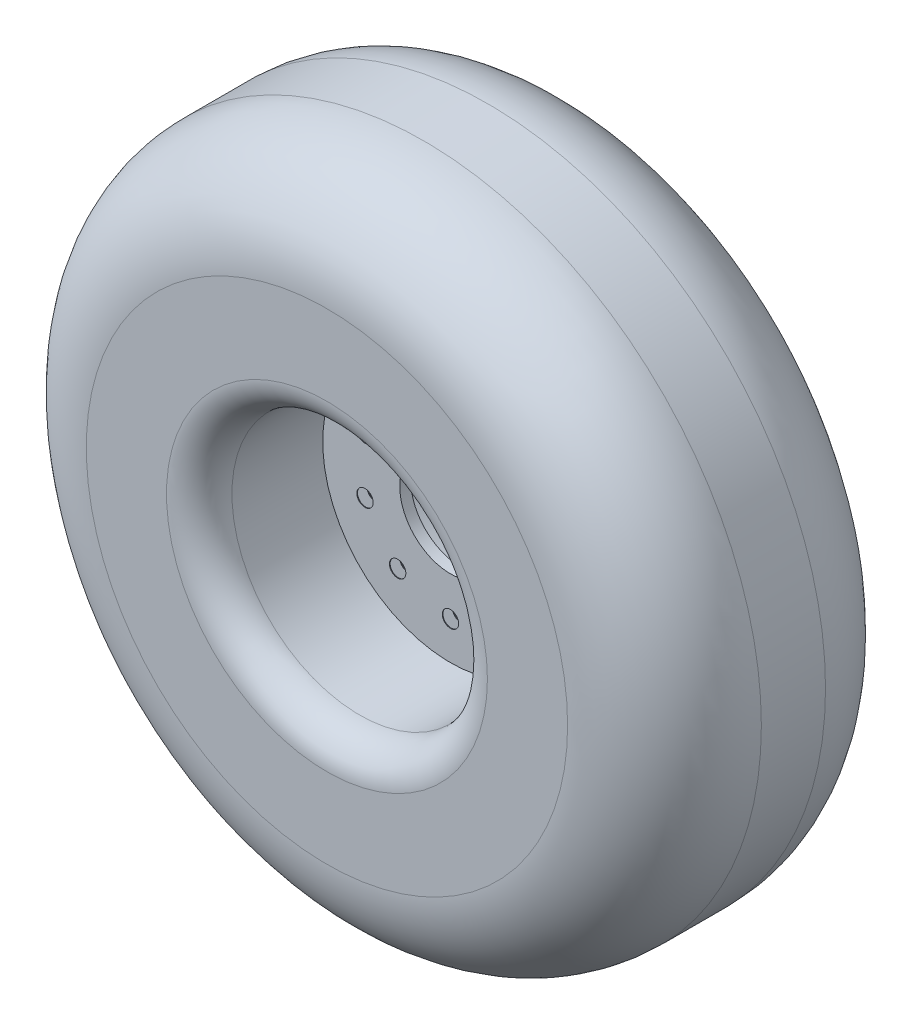
from build123d import *

# Parameters (mm, degrees)
REVOLVE_THIN2_START         = -16
REVOLVE_THIN2_OUTLINE_R     = 201.125
REVOLVE_THIN2_OUTLINE_R_2   = 79.125
REVOLVE_THIN2_DEPTH         = 1
REVOLVE_THIN2_2_OUTLINE_R   = 201.125
REVOLVE_THIN2_2_OUTLINE_R_2 = 79.125
REVOLVE_THIN2_2_DEPTH       = 1
REVOLVE_THIN2_START_2       = -15
REVOLVE_THIN2_3_OUTLINE_R   = 201.125
REVOLVE_THIN2_3_OUTLINE_R_2 = 200.125
REVOLVE_THIN2_3_OUTLINE_R_3 = 80.125
REVOLVE_THIN2_3_OUTLINE_R_4 = 79.125
REVOLVE_THIN2_3_DEPTH       = 15
SKETCH2_R                   = 12.75
CUT_EXTRUDE2_DEPTH          = 773.984657863
CIRPATTERN3_COUNT           = 10


# Read off the part's stored shape, not the designer's step: Revolve-Thin2
with BuildPart() as part:
    # Revolve-Thin2 outline → Revolve-Thin2 (new body)
    with BuildSketch(Plane.XY.offset(REVOLVE_THIN2_START)):
        Circle(REVOLVE_THIN2_OUTLINE_R)
        Circle(REVOLVE_THIN2_OUTLINE_R_2, mode=Mode.SUBTRACT)
    extrude(amount=REVOLVE_THIN2_DEPTH)



with BuildPart() as body_2:
    # Revolve-Thin2 2 outline → Revolve-Thin2 2 (new body)
    with BuildSketch(Plane.XY):
        Circle(REVOLVE_THIN2_2_OUTLINE_R)
        Circle(REVOLVE_THIN2_2_OUTLINE_R_2, mode=Mode.SUBTRACT)
    extrude(amount=REVOLVE_THIN2_2_DEPTH)


with BuildPart() as part_1:
    add(part.part)

    add(body_2.part)  # Revolve-Thin2 3 merges body 2
    # Revolve-Thin2 3 outline → Revolve-Thin2 3 (add)
    # profile 1 of 2: a face of its own
    with BuildSketch(Plane.XY.offset(REVOLVE_THIN2_START_2)):
        Circle(REVOLVE_THIN2_3_OUTLINE_R)
        Circle(REVOLVE_THIN2_3_OUTLINE_R_2, mode=Mode.SUBTRACT)
    # profile 2 of 2: a face of its own
    with BuildSketch(Plane.XY.offset(REVOLVE_THIN2_START_2)):
        Circle(REVOLVE_THIN2_3_OUTLINE_R_3)
        Circle(REVOLVE_THIN2_3_OUTLINE_R_4, mode=Mode.SUBTRACT)
    extrude(amount=REVOLVE_THIN2_3_DEPTH)

    # Sketch2 → Cut-Extrude2 (cut, through all)
    with BuildSketch(Plane.XY.offset(1)):
        with Locations((0, 140)):
            Circle(SKETCH2_R)
    cut_extrude2 = extrude(amount=-CUT_EXTRUDE2_DEPTH, mode=Mode.SUBTRACT)

    # CirPattern3: Cut-Extrude2 ×10 about axis
    cirpattern3_axis = Axis((0, 0, 0), (0, 0, 1))
    for i in range(1, CIRPATTERN3_COUNT):
        add(cut_extrude2.rotate(cirpattern3_axis, i * 360 / CIRPATTERN3_COUNT), mode=Mode.SUBTRACT)


with BuildPart() as body_2_2:
    # Revolve-Thin2 4 outline → Revolve-Thin2 4 (revolve)
    with BuildSketch(Plane.XZ):
        with BuildLine():
            Line((199.125, 142.5), (199.125, -157.5))
            ThreePointArc((199.125, -157.5), (214.062554159, -193.562445841), (250.125, -208.5))
            Line((250.125, -208.5), (375.125, -208.5))
            ThreePointArc((375.125, -208.5), (481.898123959, -164.273123959), (526.125, -57.5))
            Line((526.125, -57.5), (526.125, 42.5))
            ThreePointArc((526.125, 42.5), (481.898123959, 149.273123959), (375.125, 193.5))
            Line((375.125, 193.5), (250.125, 193.5))
            ThreePointArc((250.125, 193.5), (214.062554159, 178.562445841), (199.125, 142.5))
        make_face()
        with BuildLine():
            Line((200.125, -157.5), (200.125, 142.5))
            ThreePointArc((200.125, 142.5), (214.769660941, 177.855339059), (250.125, 192.5))
            Line((250.125, 192.5), (375.125, 192.5))
            ThreePointArc((375.125, 192.5), (481.191017178, 148.566017178), (525.125, 42.5))
            Line((525.125, 42.5), (525.125, -57.5))
            ThreePointArc((525.125, -57.5), (481.191017178, -163.566017178), (375.125, -207.5))
            Line((375.125, -207.5), (250.125, -207.5))
            ThreePointArc((250.125, -207.5), (214.769660941, -192.855339059), (200.125, -157.5))
        make_face(mode=Mode.SUBTRACT)
    revolve(axis=Axis((0, 0, 0), (0, 0, 1)))


solid = Compound([part_1.part, body_2_2.part])
